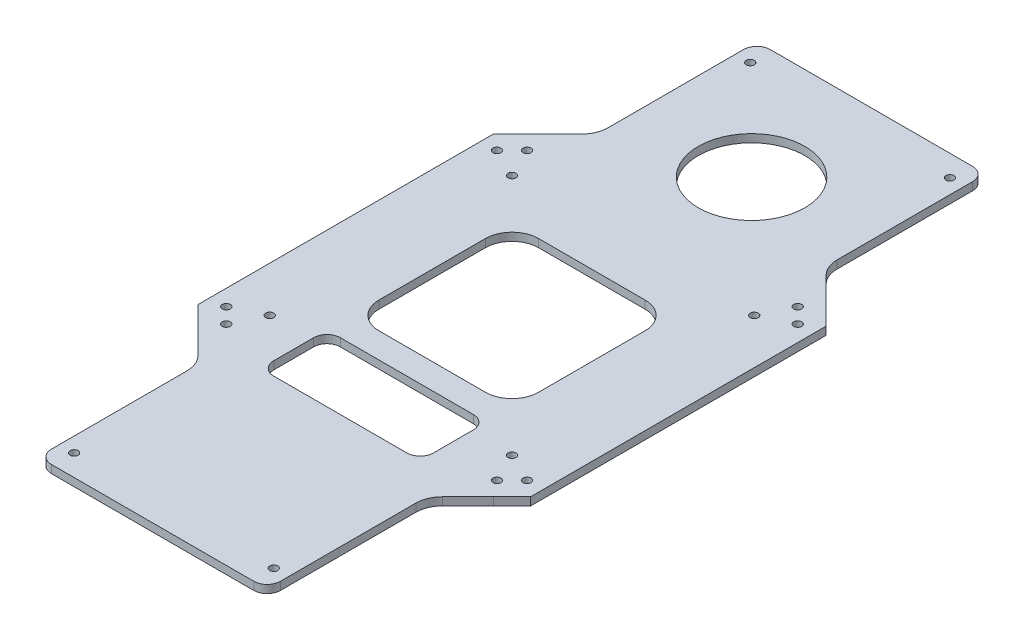
from build123d import *

# Parameters (mm, degrees)
SKETCH_1_R          = 1.5
EXTRUDE_1_DEPTH     = 3
CHAMFER_1_SIZE      = 7
SKETCH_3_W          = 60
SKETCH_3_H          = 60
SKETCH_3_R          = 1.5
SKETCH_3_R_2        = 20
SKETCH_3_H_2        = 10
SKETCH_3_H_3        = 5
CUT_EXTRUDE_1_DEPTH = 3
FILLET_3_R          = 10
FILLET_4_R          = 5
FILLET_5_R          = 5
CHAMFER_2_SIZE      = 12.5
FILLET_6_R          = 10


with BuildPart() as part:
    # 草图1 → 凸台-拉伸1 (new body)
    with BuildSketch(Plane(origin=(0, 0, 0), x_dir=(1, 0, 0), z_dir=(0, 1, 0))):
        Polygon((-62.5, 62.5), (-62.5, -62.5), (-43, -62.5), (-43, -135), (43, -135), (43, -62.5), (62.5, -62.5), (62.5, 62.5), (43, 62.5), (43, 135), (-43, 135), (-43, 62.5), align=None)
        with Locations(Location((-56.5, -50.843145751, 0), (0, 0, 270))):
            Circle(SKETCH_1_R, mode=Mode.SUBTRACT)
        with Locations(Location((-50.843145751, -56.5, 0), (0, 0, 270))):
            Circle(SKETCH_1_R, mode=Mode.SUBTRACT)
        with Locations(Location((50.843145751, -56.5, 0), (0, 0, 270))):
            Circle(SKETCH_1_R, mode=Mode.SUBTRACT)
        with Locations(Location((56.5, -50.843145751, 0), (0, 0, 270))):
            Circle(SKETCH_1_R, mode=Mode.SUBTRACT)
        with Locations(Location((-56.5, 50.843145751, 0), (0, 0, 270))):
            Circle(SKETCH_1_R, mode=Mode.SUBTRACT)
        with Locations(Location((-50.843145751, 56.5, 0), (0, 0, 270))):
            Circle(SKETCH_1_R, mode=Mode.SUBTRACT)
        with Locations(Location((50.843145751, 56.5, 0), (0, 0, 270))):
            Circle(SKETCH_1_R, mode=Mode.SUBTRACT)
        with Locations(Location((56.5, 50.843145751, 0), (0, 0, 270))):
            Circle(SKETCH_1_R, mode=Mode.SUBTRACT)
        with Locations(Location((37.5, -127, 0), (0, 0, 270))):
            Circle(SKETCH_1_R, mode=Mode.SUBTRACT)
        with Locations(Location((-37.5, -127, 0), (0, 0, 270))):
            Circle(SKETCH_1_R, mode=Mode.SUBTRACT)
        with Locations(Location((37.5, 127, 0), (0, 0, 270))):
            Circle(SKETCH_1_R, mode=Mode.SUBTRACT)
        with Locations(Location((-37.5, 127, 0), (0, 0, 270))):
            Circle(SKETCH_1_R, mode=Mode.SUBTRACT)
    extrude(amount=EXTRUDE_1_DEPTH)

    # 倒角1
    chamfer_1_edges = [part.edges().sort_by_distance(p)[0] for p in [
        (-62.5, 1.5, 62.5),
        (-62.5, 1.5, -62.5),
        (62.5, 1.5, -62.5),
        (62.5, 1.5, 62.5),
    ]]
    chamfer(chamfer_1_edges, length=CHAMFER_1_SIZE)

    # 草图3 → 切除-拉伸1 (cut)
    with BuildSketch(Plane(origin=(0, 3, 0), x_dir=(1, 0, 0), z_dir=(0, 1, 0))):
        Rectangle(SKETCH_3_W, SKETCH_3_H)
        with Locations(Location((-45.5, 45.5, 0), (0, 0, 270))):
            Circle(SKETCH_3_R)
        with Locations(Location((45.5, 45.5, 0), (0, 0, 270))):
            Circle(SKETCH_3_R)
        with Locations(Location((45.5, -45.5, 0), (0, 0, 270))):
            Circle(SKETCH_3_R)
        with Locations(Location((-45.5, -45.5, 0), (0, 0, 270))):
            Circle(SKETCH_3_R)
        with Locations(Location((0, 90, 0), (0, 0, 270))):
            Circle(SKETCH_3_R_2)
        with Locations((0, -44.5)):
            Rectangle(SKETCH_3_W, SKETCH_3_H_2)
        with Locations((0, -54.5)):
            Rectangle(SKETCH_3_W, SKETCH_3_H_2)
        with Locations((0, -62)):
            Rectangle(SKETCH_3_W, SKETCH_3_H_3)
    extrude(amount=-CUT_EXTRUDE_1_DEPTH, mode=Mode.SUBTRACT)

    # 圆角3
    fillet_3_edges = [part.edges().sort_by_distance(p)[0] for p in [
        (30, 1.5, 30),
        (-30, 1.5, 30),
        (-30, 1.5, -30),
        (30, 1.5, -30),
    ]]
    fillet(fillet_3_edges, radius=FILLET_3_R)

    # 圆角4
    fillet_4_edges = [part.edges().sort_by_distance(p)[0] for p in [
        (-43, 1.5, -135),
        (43, 1.5, -135),
        (43, 1.5, 135),
        (-43, 1.5, 135),
    ]]
    fillet(fillet_4_edges, radius=FILLET_4_R)

    # 圆角5
    fillet_5_edges = [part.edges().sort_by_distance(p)[0] for p in [
        (30, 1.5, 39.5),
        (30, 1.5, 64.5),
        (-30, 1.5, 64.5),
        (-30, 1.5, 39.5),
    ]]
    fillet(fillet_5_edges, radius=FILLET_5_R)

    # 倒角2
    chamfer_2_edges = [part.edges().sort_by_distance(p)[0] for p in [
        (43, 1.5, -62.5),
        (-43, 1.5, -62.5),
        (43, 1.5, 62.5),
        (-43, 1.5, 62.5),
    ]]
    chamfer(chamfer_2_edges, length=CHAMFER_2_SIZE - 0.0001)  # a hair under: the kernel refuses the full size

    # 圆角6
    fillet_6_edges = [part.edges().sort_by_distance(p)[0] for p in [
        (43, 1.5, -74.9999),
        (-43, 1.5, -74.9999),
        (43, 1.5, 74.9999),
        (-43, 1.5, 74.9999),
    ]]
    fillet(fillet_6_edges, radius=FILLET_6_R)


solid = part.part
